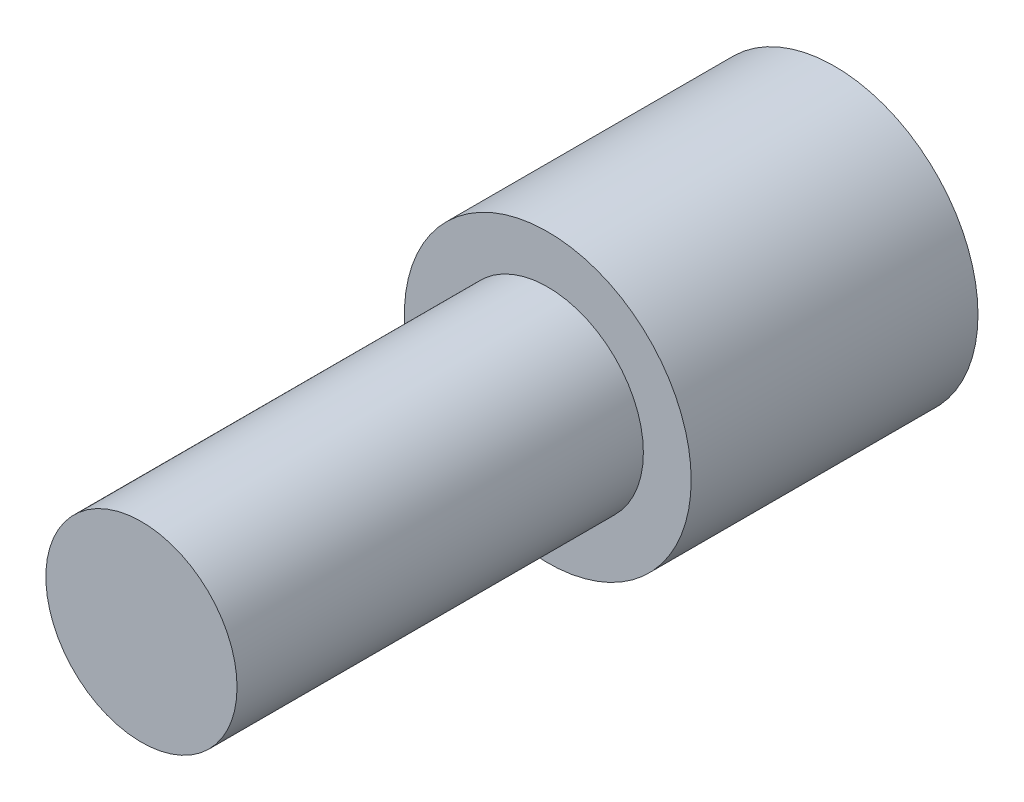
from build123d import *

# Parameters (mm, degrees)
SKETCH1_R           = 6
SKETCH1_R_2         = 4.1
BOSS_EXTRUDE1_DEPTH = 10
SKETCH2_R           = 6
BOSS_EXTRUDE2_DEPTH = 2
SKETCH3_R           = 4
BOSS_EXTRUDE3_DEPTH = 17


with BuildPart() as part:
    # Sketch1 → Boss-Extrude1 (new body)
    with BuildSketch(Plane.XY):
        Circle(SKETCH1_R)
        Circle(SKETCH1_R_2, mode=Mode.SUBTRACT)
    extrude(amount=BOSS_EXTRUDE1_DEPTH)

    # Sketch2 → Boss-Extrude2 (add)
    with BuildSketch(Plane.XY.offset(10)):
        Circle(SKETCH2_R)
    extrude(amount=BOSS_EXTRUDE2_DEPTH)

    # Sketch3 → Boss-Extrude3 (add)
    with BuildSketch(Plane.XY.offset(12)):
        Circle(SKETCH3_R)
    extrude(amount=BOSS_EXTRUDE3_DEPTH)


solid = part.part
